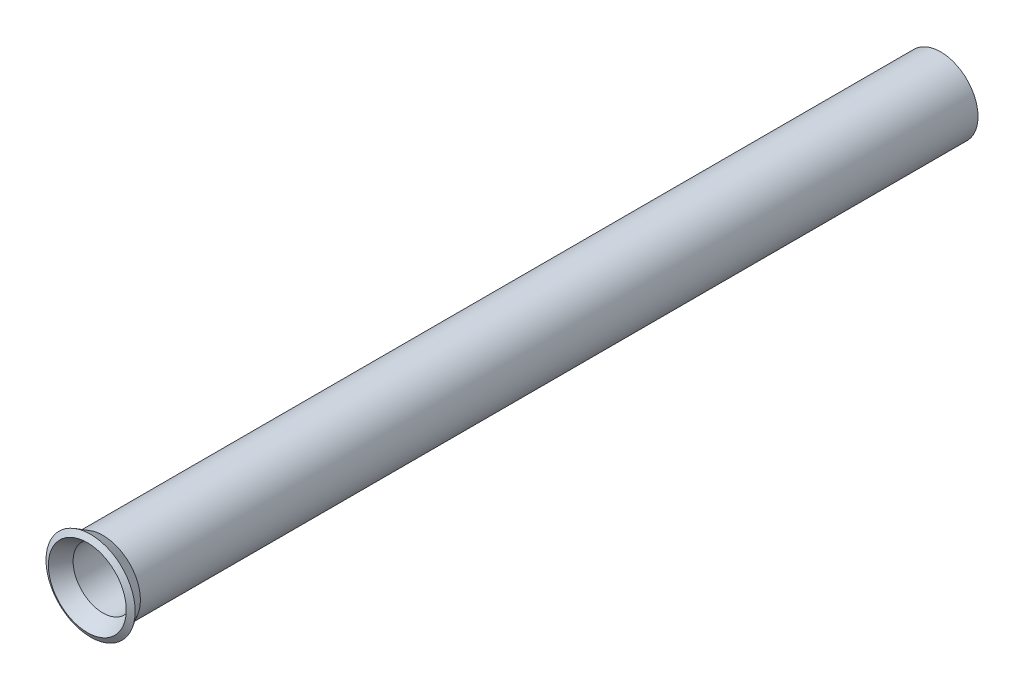
from build123d import *

# Parameters (mm, degrees)
SKETCH1_R           = 1.5875
SKETCH1_R_2         = 1.27
BOSS_EXTRUDE1_DEPTH = 35.56


with BuildPart() as part:
    # Sketch1 → Boss-Extrude1 (new body)
    with BuildSketch(Plane.XY):
        Circle(SKETCH1_R)
        Circle(SKETCH1_R_2, mode=Mode.SUBTRACT)
    extrude(amount=BOSS_EXTRUDE1_DEPTH)

    # Sketch2 → Revolve1 (revolve)
    with BuildSketch(Plane(origin=(0, 0, 0), x_dir=(1, 0, 0), z_dir=(0, 1, 0))):
        Polygon((1.5875, -35.56), (1.8923, -36.087929086), (1.654175, -36.225410619), (1.27, -35.56), align=None)
    revolve(axis=Axis((0, 0, 35.56), (0, 0, 1)))


solid = part.part
